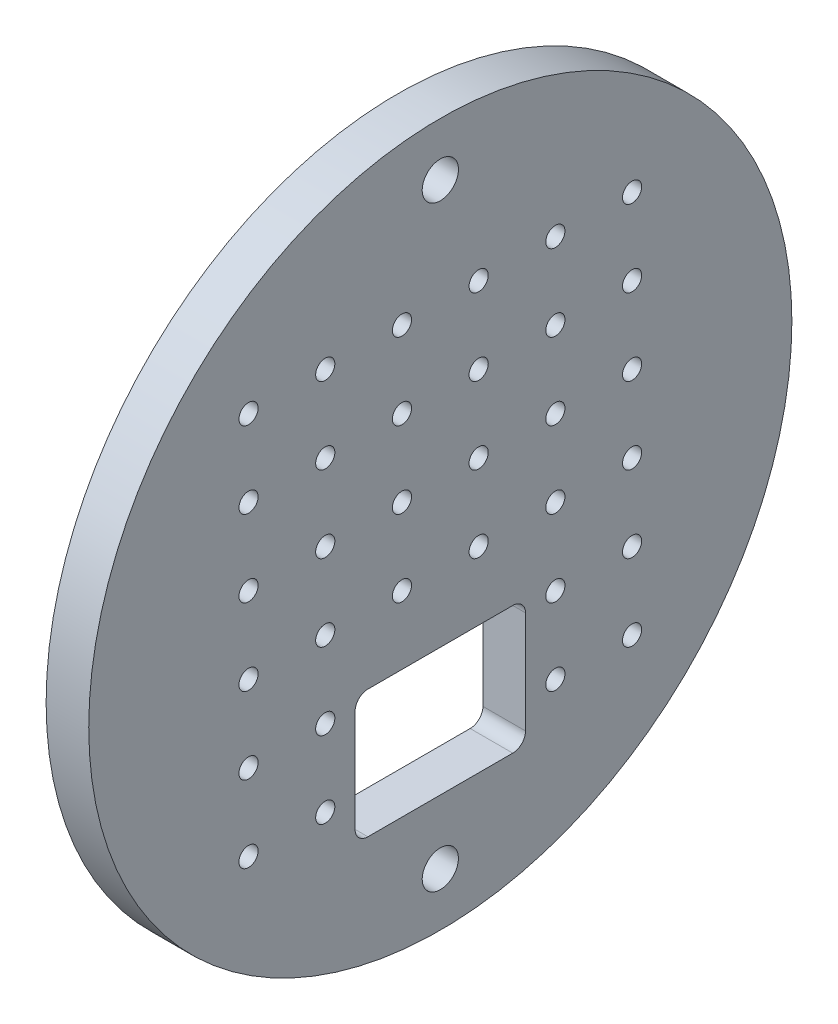
from build123d import *

# Parameters (mm, degrees)
SKETCH_1_R                  = 82.5
EXTRUDE_1_DEPTH             = 10
SKETCH_2_R                  = 4.25
CUT_EXTRUDE_499_DEPTH       = 118.100384286
CUT_EXTRUDE_1490_REACH      = 119.1
CUT_EXTRUDE_2_REACH         = 119.1
SKETCH_7_R                  = 2.25
PATTERN_LINEAR_1_COUNT      = 6
PATTERN_LINEAR_1_PITCH      = 18
PATTERN_LINEAR_1_COUNT_DIR2 = 6
PATTERN_LINEAR_1_PITCH_DIR2 = 18
WRAP_START                  = -0.3
WRAP_1_DEPTH                = 0.3


# Read off the part's stored shape, not the designer's step: 包覆1
with BuildPart() as part:
    # 草圖1 → 填料-伸長1 (new body)
    with BuildSketch(Plane(origin=(0, 0, 0), x_dir=(0, 0, -1), z_dir=(1, 0, 0))):
        Circle(SKETCH_1_R)
    extrude(amount=EXTRUDE_1_DEPTH)

    # 草圖2 → Cut-Extrude 499 (cut, through all)
    with BuildSketch(Plane(origin=(10, 0, 0), x_dir=(0, 0, -1), z_dir=(1, 0, 0))):
        with Locations((0, 70)):
            Circle(SKETCH_2_R)
        with Locations(Location((0, -70, 0), (0, 0, 180))):
            Circle(SKETCH_2_R)
    extrude(amount=-CUT_EXTRUDE_499_DEPTH, mode=Mode.SUBTRACT)

    # 草圖6 → Cut-Extrude 1490 (cut, up to next)
    with BuildSketch(Plane(origin=(10, 0, 0), x_dir=(0, 0, -1), z_dir=(1, 0, 0)), mode=Mode.PRIVATE) as cut_extrude_1490_sk1:
        with BuildLine():
            Line((-17, -25), (17, -25))
            ThreePointArc((17, -25), (19.121320344, -25.878679656), (20, -28))
            Line((20, -28), (20, -52))
            ThreePointArc((20, -52), (19.121320344, -54.121320344), (17, -55))
            Line((17, -55), (-17, -55))
            ThreePointArc((-17, -55), (-19.121320344, -54.121320344), (-20, -52))
            Line((-20, -52), (-20, -28))
            ThreePointArc((-20, -28), (-19.121320344, -25.878679656), (-17, -25))
        make_face()
    cut_extrude_1490_tool1 = extrude(cut_extrude_1490_sk1.sketch, amount=-CUT_EXTRUDE_1490_REACH, mode=Mode.PRIVATE) & part.part
    add(cut_extrude_1490_tool1.solids().sort_by_distance((10, -40, 0))[0], mode=Mode.SUBTRACT)

    # 草圖7 → Cut-Extrude 2 (cut, up to next)
    with BuildSketch(Plane(origin=(10, 0, 0), x_dir=(0, 0, -1), z_dir=(1, 0, 0)), mode=Mode.PRIVATE) as cut_extrude_2_sk1:
        with Locations((-45, 45)):
            Circle(SKETCH_7_R)
    cut_extrude_2_tool1 = extrude(cut_extrude_2_sk1.sketch, amount=-CUT_EXTRUDE_2_REACH, mode=Mode.PRIVATE) & part.part
    cut_extrude_2 = cut_extrude_2_tool1.solids().sort_by_distance((10, 45, 45))[0]
    add(cut_extrude_2, mode=Mode.SUBTRACT)

    # 直線複製排列1: Cut-Extrude 2 6 × 6, 4 skipped
    with Locations(*[(0, -j * PATTERN_LINEAR_1_PITCH_DIR2, -i * PATTERN_LINEAR_1_PITCH) for i in range(PATTERN_LINEAR_1_COUNT) for j in range(PATTERN_LINEAR_1_COUNT_DIR2) if (i, j) not in ((0, 0), (2, 4), (2, 5), (3, 4), (3, 5))]):
        add(cut_extrude_2, mode=Mode.SUBTRACT)

    # 包覆1 outline → 包覆1 (cut)
    # profile 1 of 5: a face of its own
    with BuildSketch(Plane.ZY.offset(WRAP_START)):
        with BuildLine():
            add(Edge.make_bspline(
                [(4.949047858, -62.307692308), (4.957557408, -62.272459824), (4.974192884, -62.203583199), (5.008890457, -62.105175938), (5.046689713, -62.012052417), (5.092078817, -61.925956343), (5.141587571, -61.845157441), (5.198310293, -61.771488316), (5.259630016, -61.703075351), (5.327454965, -61.642362113), (5.398583626, -61.587384384), (5.474018246, -61.540509327), (5.55224114, -61.500185174), (5.633794273, -61.466964942), (5.718920445, -61.441939418), (5.806850068, -61.423782613), (5.897813568, -61.411991498), (5.959561159, -61.410840735), (5.990914845, -61.41025641)],
                knots=[0, 0, 0, 0, 0.072625346, 0.141976611, 0.208984928, 0.27395687, 0.336889347, 0.398744953, 0.460115885, 0.520824923, 0.580994459, 0.640151928, 0.698622451, 0.757271081, 0.816426694, 0.876254048, 0.937165293, 1, 1, 1, 1], degree=3))
            Line((4.949047858, -62.307692308), (5.263150422, -62.307692308))
            add(Edge.make_bspline(
                [(5.995121576, -61.769230769), (5.955269908, -61.770622131), (5.877430331, -61.773339785), (5.765215414, -61.797142798), (5.66089608, -61.835120882), (5.581157414, -61.880453901), (5.52227484, -61.925204335), (5.480197901, -61.964286721), (5.438877391, -62.007719545), (5.401031714, -62.05817792), (5.362757737, -62.112244711), (5.327913176, -62.172668392), (5.294053484, -62.237872786), (5.273650934, -62.283968421), (5.263150422, -62.307692308)],
                knots=[0, 0, 0, 0, 0.122711942, 0.239684964, 0.351815855, 0.463766133, 0.520817793, 0.579448291, 0.640604145, 0.705297512, 0.773633881, 0.844669382, 0.920056508, 1, 1, 1, 1], degree=3))
            add(Edge.make_bspline(
                [(6.699047858, -62.318209135), (6.698633447, -62.299931389), (6.697808996, -62.263568682), (6.687411718, -62.210443614), (6.671787677, -62.158942668), (6.650307948, -62.109284858), (6.621557749, -62.061814584), (6.587151762, -62.016127135), (6.546183662, -61.972483356), (6.499238215, -61.931803036), (6.44882641, -61.893033799), (6.393576635, -61.860120162), (6.33515476, -61.8319751), (6.273496106, -61.808765598), (6.208400575, -61.79130631), (6.140174018, -61.778770468), (6.068686334, -61.770932813), (6.019914602, -61.769804398), (5.995121576, -61.769230769)],
                knots=[0, 0, 0, 0, 0.055274549, 0.109966094, 0.163247443, 0.218076185, 0.273300874, 0.3309093, 0.390994523, 0.454175953, 0.518861541, 0.583310532, 0.648516682, 0.715030887, 0.782502073, 0.852322685, 0.92492849, 1, 1, 1, 1], degree=3))
            add(Edge.make_bspline(
                [(5.80161196, -62.891025641), (5.844913126, -62.890290837), (5.929729473, -62.888851537), (6.053623777, -62.871443527), (6.172097089, -62.847362899), (6.282523831, -62.810477707), (6.383172545, -62.76763741), (6.470492147, -62.7177852), (6.543259294, -62.662370451), (6.601120366, -62.600537842), (6.644649594, -62.534222794), (6.676476392, -62.465106136), (6.695276718, -62.392582076), (6.697786385, -62.343087408), (6.699047858, -62.318209135)],
                knots=[0, 0, 0, 0, 0.110165553, 0.215787256, 0.318027435, 0.417573954, 0.511650488, 0.596162097, 0.672934533, 0.743669557, 0.810677001, 0.874058962, 0.936696302, 1, 1, 1, 1], degree=3))
            Line((5.80161196, -62.891025641), (5.80161196, -63.25))
            add(Edge.make_bspline(
                [(6.878535037, -63.990384615), (6.877004736, -63.957773277), (6.873951747, -63.892712868), (6.850643168, -63.796995294), (6.812304304, -63.704771882), (6.758631792, -63.617616091), (6.693296064, -63.53684019), (6.616931157, -63.464768707), (6.528902928, -63.405298616), (6.447883059, -63.36420996), (6.376117903, -63.336172885), (6.314702518, -63.31749792), (6.245945915, -63.301684265), (6.170679566, -63.286971993), (6.08833635, -63.274450645), (5.999005912, -63.264008829), (5.90267015, -63.255653788), (5.835978984, -63.251922693), (5.80161196, -63.25)],
                knots=[0, 0, 0, 0, 0.066909186, 0.13348544, 0.201035117, 0.27123434, 0.342879984, 0.41383613, 0.485976622, 0.560229557, 0.599884181, 0.64405484, 0.691891932, 0.744687524, 0.801491775, 0.862857698, 0.929328379, 1, 1, 1, 1], degree=3))
            add(Edge.make_bspline(
                [(5.987409236, -64.730769231), (6.020162739, -64.730153326), (6.084209385, -64.728948976), (6.177664245, -64.717873269), (6.266571692, -64.701742856), (6.349944618, -64.676829873), (6.428875125, -64.646049021), (6.502256775, -64.607400616), (6.571052881, -64.562055894), (6.634382287, -64.510516736), (6.691327794, -64.454095241), (6.741467307, -64.39508217), (6.784091969, -64.33372634), (6.818475547, -64.269688219), (6.845626097, -64.20323299), (6.864109298, -64.134174161), (6.876960813, -64.063076895), (6.878007425, -64.014747926), (6.878535037, -63.990384615)],
                knots=[0, 0, 0, 0, 0.076071737, 0.148751715, 0.218402794, 0.285759581, 0.350598024, 0.414964045, 0.478069339, 0.541760676, 0.604349859, 0.664075021, 0.721463623, 0.777587128, 0.832644447, 0.887843511, 0.943460343, 1, 1, 1, 1], degree=3))
            add(Edge.make_bspline(
                [(5.402673659, -64.541466346), (5.422270236, -64.55657468), (5.461402898, -64.586744712), (5.525171129, -64.62524634), (5.592236016, -64.658607366), (5.66405069, -64.684091061), (5.73906546, -64.705668722), (5.818492825, -64.719789241), (5.901632043, -64.729477413), (5.958399806, -64.730332344), (5.987409236, -64.730769231)],
                knots=[0, 0, 0, 0, 0.118271305, 0.236177533, 0.355662933, 0.475904165, 0.600127342, 0.728608116, 0.861313476, 1, 1, 1, 1], degree=3))
            add(Edge.make_bspline(
                [(5.128535037, -64.057692308), (5.136718329, -64.084641321), (5.152635541, -64.137059493), (5.179729839, -64.212499798), (5.210598111, -64.281657851), (5.24371267, -64.345040973), (5.278491116, -64.403273376), (5.317406041, -64.454815245), (5.357575186, -64.501930447), (5.38785454, -64.528475059), (5.402673659, -64.541466346)],
                knots=[0, 0, 0, 0, 0.149770386, 0.29131641, 0.425966373, 0.552159574, 0.671527414, 0.786121629, 0.895325073, 1, 1, 1, 1], degree=3))
            Line((5.128535037, -64.057692308), (4.814432473, -64.057692308))
            add(Edge.make_bspline(
                [(5.981800262, -65.08974359), (5.944380961, -65.088875376), (5.870752256, -65.087167022), (5.762508758, -65.075488421), (5.659187058, -65.054158416), (5.560647461, -65.025455111), (5.466802424, -64.989063368), (5.377938319, -64.94374467), (5.293508426, -64.890433168), (5.214309474, -64.828499581), (5.140350907, -64.759218241), (5.073598182, -64.681359231), (5.012938389, -64.596361827), (4.959995751, -64.503238771), (4.912358798, -64.403193513), (4.873177842, -64.294945015), (4.838692273, -64.179460993), (4.822658809, -64.098983253), (4.814432473, -64.057692308)],
                knots=[0, 0, 0, 0, 0.06554117, 0.128963168, 0.190377136, 0.250092362, 0.308548432, 0.366397963, 0.424542189, 0.483169996, 0.5422434, 0.601739352, 0.662506002, 0.724855513, 0.789127829, 0.8563464, 0.926295235, 1, 1, 1, 1], degree=3))
            add(Edge.make_bspline(
                [(7.192637601, -63.960236378), (7.190843088, -64.009246099), (7.187262506, -64.107034901), (7.155258431, -64.251509623), (7.105645191, -64.392735125), (7.035188255, -64.527809964), (6.949320746, -64.654190345), (6.847163422, -64.767266654), (6.729877013, -64.864465259), (6.599071365, -64.945675487), (6.457354236, -65.010593409), (6.305778644, -65.055650852), (6.14652859, -65.084996852), (6.037321293, -65.08814372), (5.981800262, -65.08974359)],
                knots=[0, 0, 0, 0, 0.079648251, 0.158921676, 0.239619495, 0.32260943, 0.406034637, 0.487602095, 0.569684627, 0.653036145, 0.737435718, 0.822477816, 0.909747655, 1, 1, 1, 1], degree=3))
            add(Edge.make_bspline(
                [(6.983703306, -63.338341346), (7.000544649, -63.361399098), (7.033951545, -63.407137014), (7.075187079, -63.48067344), (7.112596193, -63.555024929), (7.141746412, -63.632184336), (7.164320279, -63.711257349), (7.180456311, -63.792379745), (7.190480452, -63.875617768), (7.191916004, -63.931930248), (7.192637601, -63.960236378)],
                knots=[0, 0, 0, 0, 0.12813551, 0.254172712, 0.378111645, 0.501712263, 0.623986309, 0.747095614, 0.872874637, 1, 1, 1, 1], degree=3))
            add(Edge.make_bspline(
                [(6.604396415, -63.039663462), (6.64162817, -63.057641633), (6.715395044, -63.093261591), (6.815945574, -63.163117348), (6.907223449, -63.243773696), (6.958127168, -63.306716348), (6.983703306, -63.338341346)],
                knots=[0, 0, 0, 0, 0.2538796, 0.503008917, 0.750291081, 1, 1, 1, 1], degree=3))
            add(Edge.make_bspline(
                [(7.013150422, -62.319611378), (7.011986831, -62.356618173), (7.009709864, -62.429034727), (6.990376158, -62.534756225), (6.957839895, -62.634397825), (6.912770133, -62.728378987), (6.854428582, -62.816103827), (6.783755886, -62.897769718), (6.700253224, -62.973738876), (6.636974286, -63.017258349), (6.604396415, -63.039663462)],
                knots=[0, 0, 0, 0, 0.128067549, 0.250608319, 0.370630166, 0.490072247, 0.610374764, 0.73431307, 0.863216504, 1, 1, 1, 1], degree=3))
            add(Edge.make_bspline(
                [(5.990914845, -61.41025641), (6.036597587, -61.411635641), (6.126966598, -61.414364016), (6.259729645, -61.439278452), (6.387756464, -61.478703585), (6.509645712, -61.533177312), (6.622864144, -61.600364625), (6.723600331, -61.680329362), (6.810488842, -61.771528663), (6.88338322, -61.872261228), (6.940458219, -61.979916737), (6.982544592, -62.090716894), (7.008166273, -62.204398866), (7.01148683, -62.281156145), (7.013150422, -62.319611378)],
                knots=[0, 0, 0, 0, 0.090254249, 0.178539792, 0.266093034, 0.354630978, 0.441886153, 0.525746915, 0.608113634, 0.690197273, 0.770821484, 0.848326181, 0.92401174, 1, 1, 1, 1], degree=3))
        make_face()
    # profile 2 of 5: a face of its own
    with BuildSketch(Plane.ZY.offset(WRAP_START)):
        with BuildLine():
            add(Edge.make_bspline(
                [(4.275970935, -64.338842147), (4.253734339, -64.378285479), (4.210470731, -64.455026582), (4.136069983, -64.560458442), (4.05807791, -64.655306158), (3.972973942, -64.737035812), (3.883304263, -64.808287197), (3.788571609, -64.870625022), (3.688282791, -64.923743542), (3.582433066, -64.96849607), (3.470133515, -65.002905564), (3.351111999, -65.027209785), (3.225140503, -65.042233054), (3.138794323, -65.043978194), (3.09458071, -65.044871795)],
                knots=[0, 0, 0, 0, 0.093369857, 0.181660766, 0.265874227, 0.346354784, 0.424599862, 0.501903184, 0.579992091, 0.658443431, 0.738672236, 0.821894148, 0.908800792, 1, 1, 1, 1], degree=3))
            Line((4.275970935, -64.338842147), (3.99692446, -64.192307692))
            add(Edge.make_bspline(
                [(3.05531789, -64.730769231), (3.086669037, -64.730161174), (3.148875728, -64.728954673), (3.241516586, -64.717222762), (3.332656113, -64.698252487), (3.421917096, -64.672362496), (3.507487942, -64.640785644), (3.586733492, -64.602682787), (3.659613708, -64.56053304), (3.727730674, -64.512323365), (3.793801668, -64.453315178), (3.859344154, -64.379679457), (3.929620808, -64.292591929), (3.9736104, -64.227046263), (3.99692446, -64.192307692)],
                knots=[0, 0, 0, 0, 0.082592263, 0.163878894, 0.24565874, 0.327725695, 0.408609961, 0.485749086, 0.559169056, 0.630268476, 0.705306028, 0.792064966, 0.889796437, 1, 1, 1, 1], degree=3))
            add(Edge.make_bspline(
                [(2.122124781, -63.788461538), (2.123664387, -63.822162003), (2.126691961, -63.888432606), (2.140807104, -63.98540339), (2.163055878, -64.077776732), (2.194324941, -64.164859774), (2.232191786, -64.247789901), (2.278577503, -64.325951938), (2.333917057, -64.398989868), (2.395642756, -64.467557006), (2.464349851, -64.528617767), (2.536632599, -64.583269543), (2.613526164, -64.62907514), (2.694424247, -64.66625503), (2.779196032, -64.695361346), (2.867868227, -64.715229166), (2.960266344, -64.728536273), (3.023252078, -64.730015939), (3.05531789, -64.730769231)],
                knots=[0, 0, 0, 0, 0.068384615, 0.134475588, 0.198391058, 0.260753477, 0.321829223, 0.383037238, 0.444653123, 0.507398011, 0.569825238, 0.630777641, 0.690928687, 0.750945133, 0.811049477, 0.872330853, 0.935004094, 1, 1, 1, 1], degree=3))
            Line((2.122124781, -63.788461538), (4.410586319, -63.788461538))
            add(Edge.make_bspline(
                [(4.132240967, -62.900841346), (4.154367905, -62.931044928), (4.198474498, -62.991251046), (4.253721598, -63.089422203), (4.301678993, -63.192132798), (4.340011954, -63.301043095), (4.371051455, -63.414862675), (4.393508274, -63.53440522), (4.406677893, -63.659635131), (4.40926659, -63.744961686), (4.410586319, -63.788461538)],
                knots=[0, 0, 0, 0, 0.11852184, 0.236254763, 0.356174434, 0.477249655, 0.601539871, 0.729618382, 0.862158266, 1, 1, 1, 1], degree=3))
            add(Edge.make_bspline(
                [(3.10229305, -62.397435897), (3.154740655, -62.398789946), (3.257630901, -62.401446282), (3.407663022, -62.426072615), (3.549623739, -62.46512517), (3.683456243, -62.52027896), (3.809174104, -62.591438512), (3.925960153, -62.679580353), (4.035811666, -62.781998441), (4.099720245, -62.86076165), (4.132240967, -62.900841346)],
                knots=[0, 0, 0, 0, 0.132040234, 0.259032841, 0.381879824, 0.502258444, 0.62275219, 0.744742632, 0.870108927, 1, 1, 1, 1], degree=3))
            add(Edge.make_bspline(
                [(2.102493371, -62.874198718), (2.134201053, -62.836329848), (2.196612, -62.761791697), (2.302168355, -62.663853372), (2.416468552, -62.581809596), (2.538080178, -62.51380246), (2.668416652, -62.462128813), (2.805725943, -62.423621231), (2.951571529, -62.40204322), (3.05127675, -62.398995386), (3.10229305, -62.397435897)],
                knots=[0, 0, 0, 0, 0.128835254, 0.253589335, 0.374643257, 0.495340042, 0.616324775, 0.739759335, 0.86684232, 1, 1, 1, 1], degree=3))
            add(Edge.make_bspline(
                [(1.808022217, -63.728165064), (1.809081358, -63.688870234), (1.811180436, -63.610993069), (1.824411224, -63.495727524), (1.847859517, -63.383699072), (1.880035841, -63.274814624), (1.921587087, -63.16925649), (1.972419306, -63.066960426), (2.032611684, -62.968035287), (2.079084358, -62.905632153), (2.102493371, -62.874198718)],
                knots=[0, 0, 0, 0, 0.128044808, 0.2537679, 0.377428427, 0.500550841, 0.623295883, 0.746578332, 0.872347541, 1, 1, 1, 1], degree=3))
            add(Edge.make_bspline(
                [(3.09458071, -65.044871795), (3.045438733, -65.04372462), (2.949576971, -65.041486813), (2.810037224, -65.022194348), (2.678657806, -64.99072199), (2.555446102, -64.946756448), (2.44070385, -64.889329124), (2.334202995, -64.819369642), (2.235383469, -64.737237388), (2.14735926, -64.642220944), (2.068115377, -64.540538987), (1.998189557, -64.434583102), (1.939732126, -64.324619878), (1.892179516, -64.211349354), (1.853774651, -64.09548546), (1.827007947, -63.975973993), (1.811578199, -63.853138408), (1.809213754, -63.770041073), (1.808022217, -63.728165064)],
                knots=[0, 0, 0, 0, 0.071578658, 0.139629225, 0.204796697, 0.268134963, 0.329813747, 0.391301398, 0.453433515, 0.51655169, 0.579631271, 0.641118921, 0.701294047, 0.760810336, 0.819931722, 0.878919575, 0.938982822, 1, 1, 1, 1], degree=3))
        make_face()
        with BuildLine():
            add(Edge.make_bspline(
                [(3.118418851, -62.711538462), (3.087069413, -62.712150133), (3.025098164, -62.713359279), (2.933797096, -62.724829408), (2.846117397, -62.743789253), (2.761412109, -62.76975421), (2.680791241, -62.804362812), (2.602596472, -62.844946039), (2.528816076, -62.894487623), (2.482674781, -62.932246478), (2.459364364, -62.951322115)],
                knots=[0, 0, 0, 0, 0.131091976, 0.259141276, 0.384161763, 0.505991952, 0.629098089, 0.750669123, 0.874038938, 1, 1, 1, 1], degree=3))
            add(Edge.make_bspline(
                [(4.096483755, -63.474358974), (4.084987131, -63.432696101), (4.062859829, -63.35250848), (4.016623465, -63.24146759), (3.964551924, -63.142779689), (3.902930193, -63.057200056), (3.833111467, -62.981196543), (3.752466284, -62.914777957), (3.662030391, -62.855360506), (3.56227125, -62.805208007), (3.456629465, -62.762518148), (3.346023273, -62.733893032), (3.233165485, -62.71428349), (3.156831199, -62.712457382), (3.118418851, -62.711538462)],
                knots=[0, 0, 0, 0, 0.096240125, 0.185231261, 0.267500523, 0.344400382, 0.419594869, 0.496890627, 0.576637919, 0.660267852, 0.745386615, 0.830040327, 0.914474212, 1, 1, 1, 1], degree=3))
            Line((4.096483755, -63.474358974), (2.155077505, -63.474358974))
            add(Edge.make_bspline(
                [(2.459364364, -62.951322115), (2.442671082, -62.966416431), (2.408887948, -62.996963647), (2.363747426, -63.049592854), (2.320526954, -63.106344416), (2.281193301, -63.16938954), (2.245115715, -63.238010319), (2.211355737, -63.311627955), (2.180969325, -63.390801085), (2.163873215, -63.445973524), (2.155077505, -63.474358974)],
                knots=[0, 0, 0, 0, 0.109983845, 0.222580497, 0.338499871, 0.458708565, 0.585535346, 0.717517743, 0.85466682, 1, 1, 1, 1], degree=3))
        make_face(mode=Mode.SUBTRACT)
    # profile 3 of 5: a face of its own
    with BuildSketch(Plane.ZY.offset(WRAP_START)):
        with BuildLine():
            add(Edge.make_bspline(
                [(1.011547858, -62.980769231), (0.993157354, -62.959456084), (0.957702628, -62.918366847), (0.901471147, -62.863429781), (0.845447544, -62.817292842), (0.79039873, -62.778340583), (0.734940461, -62.748891436), (0.679723543, -62.727396574), (0.624690805, -62.714094769), (0.587904769, -62.71238033), (0.569841127, -62.711538462)],
                knots=[0, 0, 0, 0, 0.158223098, 0.305035505, 0.441308964, 0.565963227, 0.683525114, 0.79333413, 0.898517512, 1, 1, 1, 1], degree=3))
            Line((1.011547858, -62.980769231), (1.224688883, -62.761318109))
            add(Edge.make_bspline(
                [(0.569841127, -62.397435897), (0.59703319, -62.398540238), (0.651927412, -62.400769636), (0.734282038, -62.418475326), (0.81651538, -62.447608431), (0.89883873, -62.487844664), (0.98064902, -62.53991154), (1.062665876, -62.602840839), (1.145873907, -62.676218554), (1.19783022, -62.732317779), (1.224688883, -62.761318109)],
                knots=[0, 0, 0, 0, 0.105714261, 0.213411613, 0.32612673, 0.444451672, 0.56906108, 0.702712204, 0.846317947, 1, 1, 1, 1], degree=3))
            add(Edge.make_bspline(
                [(-0.076593168, -63.068409455), (-0.076058973, -63.044784057), (-0.075013477, -62.998545806), (-0.066669425, -62.930606986), (-0.051477714, -62.866058832), (-0.032422791, -62.803931969), (-0.005939787, -62.745429875), (0.025706118, -62.689772404), (0.062893543, -62.637036486), (0.105736834, -62.588033354), (0.152843479, -62.543524028), (0.203738249, -62.5047254), (0.257276506, -62.471619045), (0.313684925, -62.443853884), (0.373505398, -62.422852502), (0.436319784, -62.408395117), (0.502000939, -62.398739914), (0.546902065, -62.397876829), (0.569841127, -62.397435897)],
                knots=[0, 0, 0, 0, 0.06797849, 0.133043535, 0.196507438, 0.258613417, 0.319728338, 0.380872854, 0.442635602, 0.505079304, 0.56788052, 0.628813854, 0.688910091, 0.748765006, 0.809385783, 0.870884336, 0.934037463, 1, 1, 1, 1], degree=3))
            add(Edge.make_bspline(
                [(0.040494172, -63.462439904), (0.022363572, -63.433294289), (-0.013903963, -63.374992874), (-0.049119154, -63.277682397), (-0.073325183, -63.175237339), (-0.075487573, -63.104550485), (-0.076593168, -63.068409455)],
                knots=[0, 0, 0, 0, 0.246252371, 0.492590796, 0.740569991, 1, 1, 1, 1], degree=3))
            add(Edge.make_bspline(
                [(0.481499781, -63.811598558), (0.455453141, -63.797059426), (0.404940393, -63.76886341), (0.333393102, -63.724947329), (0.268845748, -63.680280055), (0.209745174, -63.637367216), (0.157584168, -63.593946272), (0.11256822, -63.54996902), (0.072925004, -63.507209034), (0.050977592, -63.476911737), (0.040494172, -63.462439904)],
                knots=[0, 0, 0, 0, 0.157761664, 0.305950213, 0.443775499, 0.572824362, 0.692154156, 0.802295707, 0.905564392, 1, 1, 1, 1], degree=3))
            add(Edge.make_bspline(
                [(0.869220133, -64.075220353), (0.861197739, -64.06618499), (0.843722066, -64.046502708), (0.811666825, -64.01807763), (0.773284963, -63.98743953), (0.7281448, -63.955107941), (0.676155338, -63.921509336), (0.617105863, -63.886819984), (0.55180531, -63.849392258), (0.505634679, -63.824572603), (0.481499781, -63.811598558)],
                knots=[0, 0, 0, 0, 0.076875074, 0.167461676, 0.272270023, 0.389550841, 0.520801368, 0.666263293, 0.825544915, 1, 1, 1, 1], degree=3))
            add(Edge.make_bspline(
                [(0.955458114, -64.319210737), (0.95437182, -64.296901119), (0.952227077, -64.252853763), (0.935383805, -64.189103422), (0.908770953, -64.128634141), (0.882566304, -64.093244494), (0.869220133, -64.075220353)],
                knots=[0, 0, 0, 0, 0.253475435, 0.500453315, 0.745578135, 1, 1, 1, 1], degree=3))
            add(Edge.make_bspline(
                [(0.503935678, -64.730769231), (0.534253604, -64.729398406), (0.593489746, -64.726720044), (0.678333504, -64.702402952), (0.756672131, -64.664273), (0.824695476, -64.610188302), (0.882597637, -64.547232729), (0.924525812, -64.47631861), (0.950801987, -64.399527153), (0.953887986, -64.346294851), (0.955458114, -64.319210737)],
                knots=[0, 0, 0, 0, 0.134042046, 0.261895674, 0.387836045, 0.517686206, 0.644508654, 0.764718263, 0.880290782, 1, 1, 1, 1], degree=3))
            add(Edge.make_bspline(
                [(-0.002975379, -64.461538462), (0.016797034, -64.482893226), (0.055128846, -64.524292666), (0.116430063, -64.579417007), (0.178809464, -64.625618278), (0.24164415, -64.664261693), (0.305864245, -64.694037096), (0.371109859, -64.71495569), (0.437248283, -64.728399882), (0.481670419, -64.729978164), (0.503935678, -64.730769231)],
                knots=[0, 0, 0, 0, 0.147475818, 0.285904172, 0.417171648, 0.540500744, 0.659237718, 0.775006098, 0.887228573, 1, 1, 1, 1], degree=3))
            Line((-0.002975379, -64.461538462), (-0.211208553, -64.698517628))
            add(Edge.make_bspline(
                [(0.52006148, -65.044871795), (0.484694304, -65.043879095), (0.414451377, -65.041907487), (0.310561658, -65.023401426), (0.209040899, -64.994606032), (0.110657359, -64.954890098), (0.017611245, -64.904739385), (-0.067519679, -64.844676992), (-0.145031142, -64.776686994), (-0.189149416, -64.724574084), (-0.211208553, -64.698517628)],
                knots=[0, 0, 0, 0, 0.126742519, 0.251723961, 0.377218688, 0.504693549, 0.631458239, 0.755401067, 0.877700534, 1, 1, 1, 1], degree=3))
            add(Edge.make_bspline(
                [(1.269560678, -64.305889423), (1.268841144, -64.331158569), (1.267423224, -64.380954182), (1.257565157, -64.454289012), (1.240610181, -64.52442357), (1.217516427, -64.592118854), (1.186332054, -64.656077794), (1.149784257, -64.717914043), (1.105909345, -64.776289974), (1.05581797, -64.831128934), (1.000972476, -64.881214681), (0.942466337, -64.925238635), (0.880227507, -64.961812972), (0.814700705, -64.992078318), (0.745737051, -65.016146576), (0.673325762, -65.032809107), (0.597697007, -65.042781868), (0.546267199, -65.044166344), (0.52006148, -65.044871795)],
                knots=[0, 0, 0, 0, 0.064548126, 0.127199133, 0.188597338, 0.248639515, 0.309524699, 0.370036991, 0.431889244, 0.495704286, 0.559519328, 0.62137158, 0.682397107, 0.743568482, 0.805498484, 0.868639701, 0.933066225, 1, 1, 1, 1], degree=3))
            add(Edge.make_bspline(
                [(1.150369973, -63.910456731), (1.168580501, -63.940122819), (1.20482283, -63.99916384), (1.242881096, -64.096382267), (1.264941371, -64.19949277), (1.268003591, -64.27002499), (1.269560678, -64.305889423)],
                knots=[0, 0, 0, 0, 0.248838614, 0.495235025, 0.743335604, 1, 1, 1, 1], degree=3))
            add(Edge.make_bspline(
                [(0.689732954, -63.551482372), (0.716946531, -63.566727275), (0.769514201, -63.596175407), (0.844206968, -63.641885111), (0.911994009, -63.687316535), (0.973449677, -63.731983809), (1.027391486, -63.777136676), (1.075456038, -63.821044433), (1.116444482, -63.865033742), (1.139398409, -63.895766855), (1.150369973, -63.910456731)],
                knots=[0, 0, 0, 0, 0.158989101, 0.307114592, 0.446213159, 0.574876072, 0.69415211, 0.80458118, 0.906593319, 1, 1, 1, 1], degree=3))
            add(Edge.make_bspline(
                [(0.324448499, -63.287860577), (0.332411993, -63.297645161), (0.349361285, -63.318470416), (0.3811698, -63.347374269), (0.417192303, -63.37931652), (0.460512241, -63.411253357), (0.509263269, -63.444885082), (0.564502553, -63.478887215), (0.624477058, -63.51585164), (0.667414365, -63.539296076), (0.689732954, -63.551482372)],
                knots=[0, 0, 0, 0, 0.083425105, 0.177559821, 0.28398236, 0.402216747, 0.53356848, 0.676120994, 0.831649373, 1, 1, 1, 1], degree=3))
            add(Edge.make_bspline(
                [(0.237509396, -63.055789263), (0.238620208, -63.076001307), (0.240838702, -63.116368418), (0.258085381, -63.175916452), (0.285551453, -63.23397349), (0.311221647, -63.269536396), (0.324448499, -63.287860577)],
                knots=[0, 0, 0, 0, 0.240039931, 0.479403194, 0.731756739, 1, 1, 1, 1], degree=3))
            add(Edge.make_bspline(
                [(0.569841127, -62.711538462), (0.547701737, -62.712613335), (0.504134551, -62.714728532), (0.441708733, -62.735841963), (0.383758108, -62.768250701), (0.333601128, -62.814219285), (0.291113448, -62.866983554), (0.260099767, -62.925979878), (0.241133783, -62.989427922), (0.238729051, -63.03345778), (0.237509396, -63.055789263)],
                knots=[0, 0, 0, 0, 0.124958493, 0.245900629, 0.36916603, 0.498510841, 0.628503866, 0.751028329, 0.873724174, 1, 1, 1, 1], degree=3))
        make_face()
    # profile 4 of 5: a face of its own
    with BuildSketch(Plane.ZY.offset(WRAP_START)):
        with BuildLine():
            add(Edge.make_bspline(
                [(-1.01890086, -64.557592147), (-1.054319651, -64.597631741), (-1.123439866, -64.675769512), (-1.238880984, -64.777851685), (-1.361249162, -64.862230007), (-1.489950483, -64.930379922), (-1.624868726, -64.981571979), (-1.765704814, -65.017958138), (-1.912516195, -65.041351973), (-2.012768549, -65.043687995), (-2.063572335, -65.044871795)],
                knots=[0, 0, 0, 0, 0.134298379, 0.262084975, 0.386269912, 0.507164597, 0.627300236, 0.748144942, 0.872370177, 1, 1, 1, 1], degree=3))
            Line((-1.01890086, -64.557592147), (-1.01890086, -65))
            Line((-1.01890086, -65), (-0.704798296, -65))
            Line((-0.704798296, -65), (-0.704798296, -62.442307692))
            Line((-0.704798296, -62.442307692), (-1.01890086, -62.442307692))
            Line((-1.01890086, -62.442307692), (-1.01890086, -62.915564904))
            add(Edge.make_bspline(
                [(-2.053756629, -62.397435897), (-2.00155677, -62.398873649), (-1.89919531, -62.401693012), (-1.749467301, -62.425155739), (-1.607822823, -62.464794206), (-1.473168471, -62.518711704), (-1.345987785, -62.590360433), (-1.227484801, -62.680740394), (-1.116419318, -62.789281581), (-1.052039026, -62.872652026), (-1.01890086, -62.915564904)],
                knots=[0, 0, 0, 0, 0.129862142, 0.254653531, 0.376014554, 0.495255252, 0.614797719, 0.738105554, 0.8651963, 1, 1, 1, 1], degree=3))
            add(Edge.make_bspline(
                [(-3.397105988, -63.714142628), (-3.395853017, -63.669678925), (-3.39337596, -63.581776581), (-3.37492274, -63.452497883), (-3.343891732, -63.327979623), (-3.300343884, -63.208622679), (-3.244501929, -63.094282629), (-3.176573842, -62.984878604), (-3.096554717, -62.880109207), (-3.00430231, -62.78243798), (-2.90436754, -62.692217366), (-2.797458809, -62.61380832), (-2.686235528, -62.546091471), (-2.568972517, -62.492437995), (-2.447405413, -62.449028891), (-2.320451967, -62.418995922), (-2.188640388, -62.401298601), (-2.099149896, -62.398735837), (-2.053756629, -62.397435897)],
                knots=[0, 0, 0, 0, 0.063774532, 0.12607881, 0.186904093, 0.247573935, 0.308003356, 0.369131898, 0.432033228, 0.496790794, 0.561610823, 0.624913866, 0.686726349, 0.748078833, 0.809582291, 0.871630743, 0.934885821, 1, 1, 1, 1], degree=3))
            add(Edge.make_bspline(
                [(-2.063572335, -65.044871795), (-2.108740288, -65.043645423), (-2.197813493, -65.041226962), (-2.32884257, -65.022464659), (-2.45493482, -64.992334037), (-2.576209393, -64.950433147), (-2.691881538, -64.894852326), (-2.802941635, -64.828311078), (-2.908814327, -64.749070248), (-3.007885866, -64.658482219), (-3.099117866, -64.560087232), (-3.179179139, -64.455141685), (-3.245932219, -64.344099381), (-3.301752299, -64.228366227), (-3.344748644, -64.107051308), (-3.374722278, -63.98057414), (-3.393462725, -63.849084266), (-3.395880185, -63.759544743), (-3.397105988, -63.714142628)],
                knots=[0, 0, 0, 0, 0.064619991, 0.127433484, 0.189004127, 0.249930071, 0.310668454, 0.372328961, 0.43493911, 0.499575544, 0.564191208, 0.626735217, 0.688109334, 0.749293607, 0.810330528, 0.87190117, 0.935045915, 1, 1, 1, 1], degree=3))
        make_face()
        with BuildLine():
            add(Edge.make_bspline(
                [(-3.083003424, -63.717648237), (-3.081138531, -63.761238344), (-3.077416054, -63.8482477), (-3.05066536, -63.977228277), (-3.005785486, -64.102882319), (-2.944543424, -64.224143313), (-2.867856799, -64.336727413), (-2.778968146, -64.438467536), (-2.677017865, -64.525957124), (-2.564090358, -64.599194697), (-2.443482388, -64.658357218), (-2.316648456, -64.699522858), (-2.185972818, -64.726100638), (-2.097120484, -64.729205115), (-2.052354386, -64.730769231)],
                knots=[0, 0, 0, 0, 0.081589349, 0.162858895, 0.245483689, 0.330807139, 0.416493374, 0.499893203, 0.583048156, 0.667157852, 0.751311929, 0.833784789, 0.916256489, 1, 1, 1, 1], degree=3))
            add(Edge.make_bspline(
                [(-2.049549899, -62.711538462), (-2.095464237, -62.713172099), (-2.186091837, -62.71639664), (-2.319135839, -62.741570135), (-2.446449253, -62.78345473), (-2.567395327, -62.840736631), (-2.680063544, -62.912765368), (-2.780757214, -62.999886751), (-2.870299916, -63.099723765), (-2.94560818, -63.211825875), (-3.006998677, -63.332003967), (-3.050165709, -63.457628405), (-3.078634956, -63.586433382), (-3.081543477, -63.673796068), (-3.083003424, -63.717648237)],
                knots=[0, 0, 0, 0, 0.085920517, 0.169593435, 0.252475515, 0.336244477, 0.419504521, 0.502035907, 0.584774648, 0.669846475, 0.754184866, 0.836658238, 0.918009726, 1, 1, 1, 1], degree=3))
            add(Edge.make_bspline(
                [(-1.01890086, -63.726762821), (-1.019860517, -63.69142499), (-1.021749424, -63.621868957), (-1.036179994, -63.519741439), (-1.05913492, -63.422007713), (-1.09148109, -63.328565024), (-1.133972374, -63.239930009), (-1.18522014, -63.155466248), (-1.24612559, -63.075613037), (-1.315708286, -63.001469966), (-1.391873489, -62.933843504), (-1.472468029, -62.873479263), (-1.558446776, -62.82389049), (-1.648363813, -62.782849219), (-1.742375148, -62.750190069), (-1.841245767, -62.728402375), (-1.943924754, -62.713442054), (-2.01397081, -62.712179673), (-2.049549899, -62.711538462)],
                knots=[0, 0, 0, 0, 0.0656338, 0.129188088, 0.191218683, 0.251912818, 0.312507474, 0.373494434, 0.4351516, 0.498741474, 0.562095217, 0.624186567, 0.685475718, 0.746096815, 0.807611636, 0.869966581, 0.933951019, 1, 1, 1, 1], degree=3))
            add(Edge.make_bspline(
                [(-2.052354386, -64.730769231), (-2.006907883, -64.729109267), (-1.916519297, -64.725807763), (-1.783080589, -64.700526498), (-1.653585626, -64.6587577), (-1.529798398, -64.600858573), (-1.414482266, -64.529101217), (-1.310984389, -64.445094126), (-1.22346842, -64.347390942), (-1.149275811, -64.240014489), (-1.091100394, -64.122302492), (-1.048724335, -63.996968302), (-1.023670429, -63.864007553), (-1.0205127, -63.773143626), (-1.01890086, -63.726762821)],
                knots=[0, 0, 0, 0, 0.084802388, 0.16866354, 0.252551924, 0.338239689, 0.423102661, 0.505556051, 0.586175656, 0.66713572, 0.74849918, 0.830452399, 0.913455706, 1, 1, 1, 1], degree=3))
        make_face(mode=Mode.SUBTRACT)
    # profile 5 of 5: a face of its own
    with BuildSketch(Plane.ZY.offset(WRAP_START)):
        with BuildLine():
            add(Edge.make_bspline(
                [(-5.316777463, -61.5), (-5.283348985, -61.50017575), (-5.218556274, -61.500516398), (-5.124336832, -61.50579953), (-5.036088022, -61.513003199), (-4.953784249, -61.524433292), (-4.877463547, -61.538225069), (-4.80689591, -61.554926885), (-4.742305738, -61.574953499), (-4.665193001, -61.60679978), (-4.57727234, -61.654122949), (-4.482073948, -61.724051514), (-4.400669708, -61.809583977), (-4.330483391, -61.906066632), (-4.274682271, -62.012202404), (-4.234312974, -62.125461593), (-4.208755099, -62.244383335), (-4.206126664, -62.326026513), (-4.204798296, -62.36728766)],
                knots=[0, 0, 0, 0, 0.062594097, 0.121322939, 0.176680142, 0.228365096, 0.276868446, 0.321879128, 0.364098625, 0.403355696, 0.477967948, 0.550535461, 0.623584457, 0.698174882, 0.77335367, 0.847281125, 0.92281834, 1, 1, 1, 1], degree=3))
            Line((-5.316777463, -61.5), (-5.999670091, -61.5))
            Line((-5.999670091, -61.5), (-5.999670091, -65))
            Line((-5.999670091, -65), (-5.053155668, -65))
            add(Edge.make_bspline(
                [(-3.935567527, -64.006510417), (-3.936544373, -64.040677289), (-3.938466345, -64.107901567), (-3.952646317, -64.206656701), (-3.976655424, -64.301031648), (-4.00972657, -64.391636831), (-4.052888885, -64.478296965), (-4.105416849, -64.561110229), (-4.168048413, -64.63924456), (-4.238111282, -64.713568183), (-4.317373427, -64.78039597), (-4.402889182, -64.839911677), (-4.495735502, -64.888857739), (-4.594387496, -64.929973761), (-4.699951812, -64.961380959), (-4.811954419, -64.983353533), (-4.930298721, -64.99815857), (-5.011508472, -64.999375775), (-5.053155668, -65)],
                knots=[0, 0, 0, 0, 0.061160277, 0.120334558, 0.178180255, 0.235235126, 0.292682961, 0.351186248, 0.41045661, 0.471719854, 0.533761203, 0.595739024, 0.657887515, 0.72129518, 0.786822515, 0.854686154, 0.925477986, 1, 1, 1, 1], degree=3))
            add(Edge.make_bspline(
                [(-4.609345572, -63.111879006), (-4.569585144, -63.127144005), (-4.493513597, -63.15634973), (-4.388827584, -63.207985194), (-4.298632739, -63.264147304), (-4.222235593, -63.325479154), (-4.156897938, -63.391587965), (-4.099844997, -63.463443079), (-4.051163623, -63.541981837), (-4.009450699, -63.626385373), (-3.976901943, -63.715791841), (-3.952526039, -63.809362617), (-3.93855859, -63.906762172), (-3.936570948, -63.973047552), (-3.935567527, -64.006510417)],
                knots=[0, 0, 0, 0, 0.106057493, 0.202914257, 0.290300165, 0.370222566, 0.446383721, 0.5213969, 0.598291083, 0.676142469, 0.7555287, 0.834887172, 0.916646049, 1, 1, 1, 1], degree=3))
            add(Edge.make_bspline(
                [(-4.204798296, -62.36728766), (-4.205891515, -62.405940216), (-4.208039792, -62.481896133), (-4.228582551, -62.592990242), (-4.26074322, -62.698741461), (-4.305448469, -62.798763846), (-4.363550465, -62.89079746), (-4.432408784, -62.975584726), (-4.515485586, -63.049535783), (-4.577728826, -63.090878685), (-4.609345572, -63.111879006)],
                knots=[0, 0, 0, 0, 0.130569107, 0.256580609, 0.380551617, 0.503622917, 0.625739323, 0.747548582, 0.871766119, 1, 1, 1, 1], degree=3))
        make_face()
        with BuildLine():
            add(Edge.make_bspline(
                [(-5.238251822, -64.641025641), (-5.206232896, -64.640641894), (-5.144520637, -64.639902271), (-5.055419407, -64.637487717), (-4.972836303, -64.631995441), (-4.897148168, -64.623349591), (-4.827537715, -64.613971142), (-4.764840012, -64.601359861), (-4.708546819, -64.586910901), (-4.643272511, -64.564576728), (-4.569769002, -64.529880257), (-4.490558146, -64.477566031), (-4.420131928, -64.415242723), (-4.360326669, -64.343111809), (-4.31131368, -64.264680482), (-4.275658225, -64.181535132), (-4.253667368, -64.095049605), (-4.251005199, -64.036082892), (-4.249670091, -64.006510417)],
                knots=[0, 0, 0, 0, 0.072502489, 0.139738989, 0.201795135, 0.259821934, 0.312205989, 0.360773434, 0.404540343, 0.443698099, 0.516840794, 0.587874336, 0.657965418, 0.728969389, 0.79930772, 0.866635778, 0.933116329, 1, 1, 1, 1], degree=3))
            Line((-5.238251822, -64.641025641), (-5.685567527, -64.641025641))
            Line((-5.685567527, -64.641025641), (-5.685567527, -63.33974359))
            Line((-5.685567527, -63.33974359), (-5.477334354, -63.33974359))
            add(Edge.make_bspline(
                [(-4.822486597, -63.381109776), (-4.839515693, -63.377654692), (-4.876438286, -63.370163357), (-4.936645866, -63.362255654), (-5.005381735, -63.355210594), (-5.082804612, -63.349999436), (-5.169012453, -63.344612893), (-5.264189372, -63.342518071), (-5.367946687, -63.340018811), (-5.439939059, -63.339837677), (-5.477334354, -63.33974359)],
                knots=[0, 0, 0, 0, 0.079306486, 0.171952819, 0.277056507, 0.394730576, 0.526177321, 0.671344767, 0.829285257, 1, 1, 1, 1], degree=3))
            add(Edge.make_bspline(
                [(-4.249670091, -64.006510417), (-4.249946195, -63.988017076), (-4.25049395, -63.951328694), (-4.258754565, -63.897412875), (-4.270768435, -63.845187002), (-4.286299869, -63.794509261), (-4.308919336, -63.746295885), (-4.335325881, -63.699593325), (-4.366287283, -63.654339846), (-4.414531449, -63.597127593), (-4.484703433, -63.53121058), (-4.584410209, -63.466673077), (-4.697782507, -63.41462527), (-4.780009999, -63.392525794), (-4.822486597, -63.381109776)],
                knots=[0, 0, 0, 0, 0.060287398, 0.119602355, 0.177503371, 0.235142664, 0.292132593, 0.350871209, 0.410097863, 0.470731522, 0.594828704, 0.722578824, 0.85669139, 1, 1, 1, 1], degree=3))
        make_face(mode=Mode.SUBTRACT)
        with BuildLine():
            add(Edge.make_bspline(
                [(-5.474529867, -62.980769231), (-5.443681071, -62.980369308), (-5.384074912, -62.979596575), (-5.297755015, -62.977383058), (-5.217629997, -62.971185015), (-5.143838164, -62.964988752), (-5.07649572, -62.954914165), (-5.015751859, -62.942922042), (-4.960653262, -62.930239137), (-4.897113716, -62.90866965), (-4.825040768, -62.876791975), (-4.748207664, -62.827320139), (-4.680473194, -62.768395785), (-4.623276006, -62.700404824), (-4.576464536, -62.625538638), (-4.543950821, -62.544991757), (-4.521903536, -62.460771625), (-4.519912005, -62.402953373), (-4.51890086, -62.373597756)],
                knots=[0, 0, 0, 0, 0.072301034, 0.139700332, 0.202288511, 0.260599533, 0.313190329, 0.361738933, 0.405706476, 0.445539985, 0.518831956, 0.58977824, 0.658867479, 0.728430478, 0.797282704, 0.864815377, 0.931363753, 1, 1, 1, 1], degree=3))
            Line((-5.474529867, -62.980769231), (-5.685567527, -62.980769231))
            Line((-5.685567527, -62.980769231), (-5.685567527, -61.858974359))
            Line((-5.685567527, -61.858974359), (-5.259285476, -61.858974359))
            add(Edge.make_bspline(
                [(-4.51890086, -62.373597756), (-4.51942704, -62.354171985), (-4.5204592, -62.316066213), (-4.528912503, -62.260516859), (-4.543280077, -62.208273106), (-4.561734371, -62.158618996), (-4.587523059, -62.113107146), (-4.617886523, -62.07016395), (-4.654572213, -62.031251831), (-4.696329526, -61.994882333), (-4.744338148, -61.962637805), (-4.79856944, -61.934397042), (-4.859757117, -61.911656265), (-4.926869972, -61.891740113), (-5.00094106, -61.877751819), (-5.081115613, -61.866098431), (-5.168050332, -61.860165689), (-5.228195435, -61.859380327), (-5.259285476, -61.858974359)],
                knots=[0, 0, 0, 0, 0.057003133, 0.111817869, 0.164402372, 0.215869805, 0.26684111, 0.317478963, 0.369902136, 0.423400449, 0.479718398, 0.539241497, 0.602430689, 0.671029546, 0.744484798, 0.823453971, 0.908740313, 1, 1, 1, 1], degree=3))
        make_face(mode=Mode.SUBTRACT)
    extrude(amount=WRAP_1_DEPTH, mode=Mode.SUBTRACT)


solid = part.part
